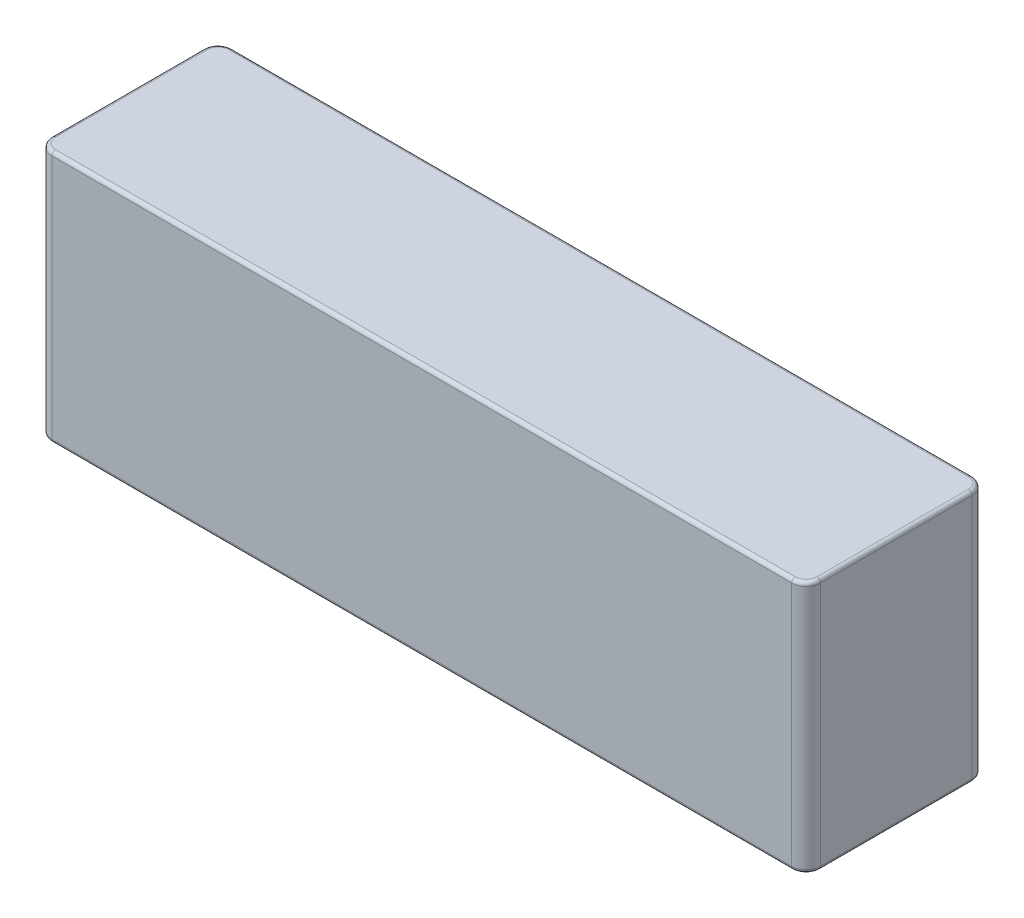
from build123d import *

# Parameters (mm, degrees)
SKETCH1_W           = 106.5
SKETCH1_H           = 35
BOSS_EXTRUDE1_DEPTH = 25
FILLET1_R           = 2
FILLET2_R           = 0.5


with BuildPart() as part:
    # Sketch1 → Boss-Extrude1 (new body)
    with BuildSketch(Plane.XY):
        Rectangle(SKETCH1_W, SKETCH1_H)
    extrude(amount=BOSS_EXTRUDE1_DEPTH)

    # Fillet1
    fillet1_edges = [part.edges().sort_by_distance(p)[0] for p in [
        (-53.25, 0, 0),
        (-53.25, 0, 25),
        (53.25, 0, 25),
        (53.25, 0, 0),
    ]]
    fillet(fillet1_edges, radius=FILLET1_R)

    # Fillet2
    fillet2_edges = [part.edges().sort_by_distance(p)[0] for p in [
        (-52.664213562, -17.5, 24.414213562),
        (-53.25, -17.5, 12.5),
        (-52.664213562, -17.5, 0.585786438),
        (0, -17.5, 0),
        (52.664213562, -17.5, 0.585786438),
        (53.25, -17.5, 12.5),
        (52.664213562, -17.5, 24.414213562),
        (52.664213562, 17.5, 24.414213562),
        (53.25, 17.5, 12.5),
        (52.664213562, 17.5, 0.585786438),
        (0, 17.5, 0),
        (-52.664213562, 17.5, 0.585786438),
        (-53.25, 17.5, 12.5),
        (-52.664213562, 17.5, 24.414213562),
        (0, -17.5, 25),
        (0, 17.5, 25),
    ]]
    fillet(fillet2_edges, radius=FILLET2_R)


solid = part.part
